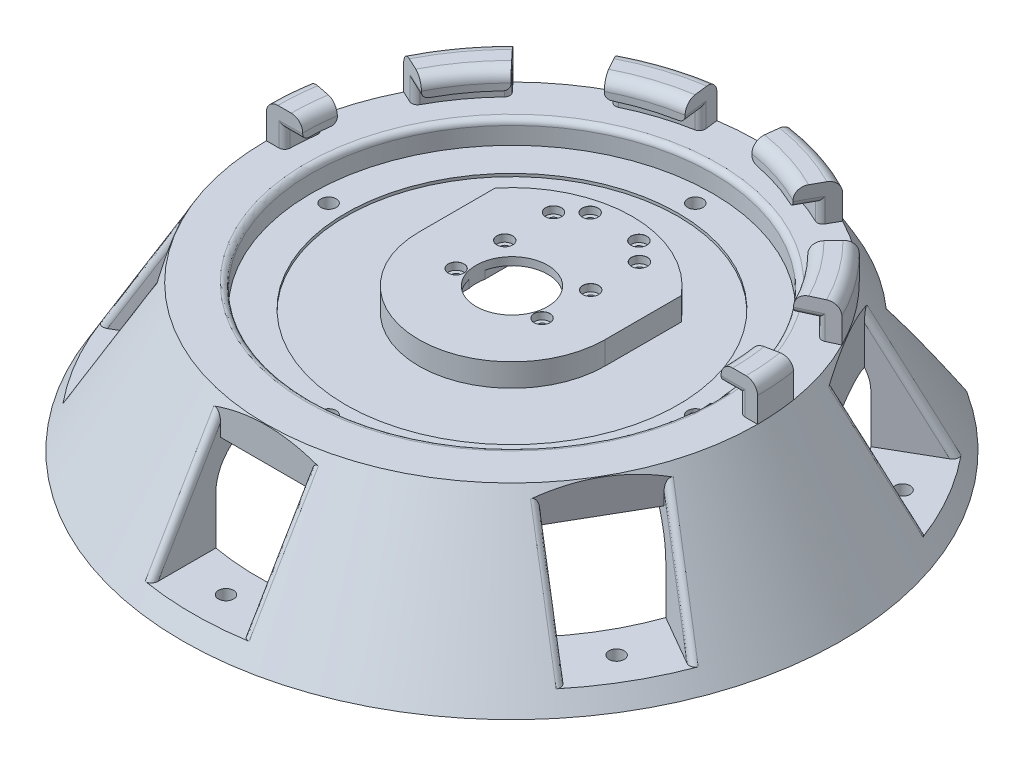
from build123d import *

# Parameters (mm, degrees)
SKETCH2_R                       = 12.5
CUT_EXTRUDE1_DEPTH              = 171.457229262
SKETCH3_R                       = 69.999999954
CUT_EXTRUDE2_DEPTH              = 8.000000002
CUT_EXTRUDE5_DEPTH              = 39
SKETCH8_W                       = 31.75
SKETCH8_H                       = 38.1
CUT_EXTRUDE6_DEPTH              = 44.45
CIRPATTERN2_COUNT               = 6
SKETCH9_R                       = 2.649982
CUT_EXTRUDE7_DEPTH              = 171.457229262
CIRPATTERN3_COUNT               = 6
REVOLVE2_ANGLE                  = 180
CUT_EXTRUDE9_DEPTH              = 12.7
SKETCH3_3_R                     = 12.5
CUT_EXTRUDE11_DEPTH             = 1
CBORE_FOR_M2_5_SHCS1_AT_2_COUNT = 2
CBORE_FOR_M2_5_SHCS1_AT_2_PITCH = 17
CBORE_FOR_M2_5_SHCS1_AT_3_COUNT = 2
CBORE_FOR_M2_5_SHCS1_AT_3_PITCH = 34
CBORE_FOR_M2_5_SHCS1_AT_4_COUNT = 2
CBORE_FOR_M2_5_SHCS1_AT_4_PITCH = 40.820828017
CBORE_FOR_M2_5_SHCS1_AT_5_COUNT = 2
CBORE_FOR_M2_5_SHCS1_AT_5_PITCH = 46.651259361
CBORE_FOR_M2_5_SHCS1_AT_6_COUNT = 2
CBORE_FOR_M2_5_SHCS1_AT_6_PITCH = 45.343136195
CBORE_FOR_M2_5_SHCS1_AT_7_COUNT = 2
CBORE_FOR_M2_5_SHCS1_AT_7_PITCH = 34.481879299
CBORE_FOR_M2_5_SHCS1_AT_8_COUNT = 2
CBORE_FOR_M2_5_SHCS1_AT_8_PITCH = 30
FILLET1_R                       = 4
FILLET2_R                       = 2
FILLET3_R                       = 2
FILLET4_R                       = 2
FILLET5_R                       = 2
FILLET6_R                       = 16
FILLET7_R                       = 16
FILLET8_R                       = 16
FILLET9_R                       = 1
CUT_EXTRUDE12_DEPTH             = 8.05
CUT_EXTRUDE15_START             = -5.3
SKETCH20_R                      = 1.45
CUT_EXTRUDE15_DEPTH             = 5.3
M5_CLEARANCE_HOLE1_D            = 5.3
SKETCH34_R                      = 58
CUT_EXTRUDE16_DEPTH             = 1


# Some blends are built 0.0001 mm under size
with BuildPart() as part:
    # Sketch1 → Revolve1 (revolve)
    with BuildSketch(Plane.XY, mode=Mode.PRIVATE) as revolve1_sk:
        Polygon((0, 0), (-85.725, 0), (-115.054393675, -50.8), (0, -50.8), align=None)
    revolve(revolve1_sk.sketch.rotate(Axis((0, 0, 0), (0, -1, 0)), 270), axis=Axis((0, 0, 0), (0, -1, 0)))

    # Sketch2 → Cut-Extrude1 (cut, through all)
    with BuildSketch(Plane(origin=(0, 0, 0), x_dir=(1, 0, 0), z_dir=(0, 1, 0))):
        with Locations(Location((0, 0, 0), (0, 0, 270))):
            Circle(SKETCH2_R)
    extrude(amount=-CUT_EXTRUDE1_DEPTH, mode=Mode.SUBTRACT)

    # Sketch3 → Cut-Extrude2 (cut)
    with BuildSketch(Plane(origin=(0, 0, 0), x_dir=(1, 0, 0), z_dir=(0, 1, 0))):
        with Locations(Location((0, 0, 0), (0, 0, 270))):
            Circle(SKETCH3_R)
        with BuildLine():
            ThreePointArc((32.5, 0), (0, -32.5), (-32.5, 0))
            Line((-32.5, 0), (-32.5, 26.603571189))
            ThreePointArc((-32.5, 26.603571189), (0, 42), (32.5, 26.603571189))
            Line((32.5, 26.603571189), (32.5, 0))
        make_face(mode=Mode.SUBTRACT)
    extrude(amount=-CUT_EXTRUDE2_DEPTH, mode=Mode.SUBTRACT)

    # Sketch7 → Cut-Extrude5 (cut)
    with BuildSketch(Plane.XZ.offset(50.8)):
        with BuildLine():
            Line((-60, -65.598856697), (-60, -161.1))
            Line((-60, -161.1), (60, -161.1))
            Line((60, -161.1), (60, -65.598856697))
            ThreePointArc((60, -65.598856697), (0, 88.9), (-60, -65.598856697))
        make_face()
    extrude(amount=-CUT_EXTRUDE5_DEPTH, mode=Mode.SUBTRACT)

    # Sketch8 → Cut-Extrude6 (cut)
    with BuildSketch(Plane(origin=(0, 0, 0), x_dir=(1, 0, 0), z_dir=(0, 1, 0))):
        with Locations((0, -104.875)):
            Rectangle(SKETCH8_W, SKETCH8_H)
    cut_extrude6 = extrude(amount=-CUT_EXTRUDE6_DEPTH, mode=Mode.SUBTRACT)

    # CirPattern2: Cut-Extrude6 ×6 about axis, 1 skipped
    cirpattern2_axis = Axis((0, 0, 0), (0, -1, 0))
    add([cut_extrude6.rotate(cirpattern2_axis, i * 360 / CIRPATTERN2_COUNT) for i in range(1, CIRPATTERN2_COUNT) if i not in (3,)], mode=Mode.SUBTRACT)

    # Sketch9 → Cut-Extrude7 (cut, through all)
    with BuildSketch(Plane(origin=(0, 0, 0), x_dir=(1, 0, 0), z_dir=(0, 1, 0))):
        with Locations(Location((0, -99.814393675, 0), (0, 0, 270))):
            Circle(SKETCH9_R)
    cut_extrude7 = extrude(amount=-CUT_EXTRUDE7_DEPTH, mode=Mode.SUBTRACT)

    # CirPattern3: Cut-Extrude7 ×6 about axis
    cirpattern3_axis = Axis((0, 0, 0), (0, 1, 0))
    for i in range(1, CIRPATTERN3_COUNT):
        add(cut_extrude7.rotate(cirpattern3_axis, i * 360 / CIRPATTERN3_COUNT), mode=Mode.SUBTRACT)

    # Sketch12 → Revolve2 (revolve)
    with BuildSketch(Plane.XY):
        Polygon((85.725, 0), (85.725, 12.7), (73.025, 12.7), (73.025, 6.35), (79.375, 6.35), (79.375, 0), align=None)
    revolve(axis=Axis((0, 0, 0), (0, 1, 0)), revolution_arc=REVOLVE2_ANGLE)

    # Sketch18 → Cut-Extrude9 (cut)
    with BuildSketch(Plane(origin=(0, 12.7, 0), x_dir=(1, 0, 0), z_dir=(0, 1, 0))):
        Polygon((46.643270314, 89.718478222), (70.913780145, 72.084920653), (36.670415564, 35.160782448), (22.108109665, 45.740916989), align=None)
        Polygon((-15, 100), (-9, 50), (9, 50), (15, 100), align=None)
        Polygon((90.470396714, 45.167547182), (99.740906545, 16.635851693), (50.333978764, 6.891341072), (44.771672865, 24.010358365), align=None)
        Polygon((99.740906545, -16.635851693), (90.470396714, -45.167547182), (44.771672865, -24.010358365), (50.333978764, -6.891341072), align=None)
        Polygon((70.913780145, -72.084920653), (46.643270314, -89.718478222), (22.108109665, -45.740916989), (36.670415564, -35.160782448), align=None)
        Polygon((15, -100), (-15, -100), (-9, -50), (9, -50), align=None)
        Polygon((-46.643270314, -89.718478222), (-70.913780145, -72.084920653), (-36.670415564, -35.160782448), (-22.108109665, -45.740916989), align=None)
        Polygon((-90.470396714, -45.167547182), (-99.740906545, -16.635851693), (-50.333978764, -6.891341072), (-44.771672865, -24.010358365), align=None)
        Polygon((-99.740906545, 16.635851693), (-90.470396714, 45.167547182), (-44.771672865, 24.010358365), (-50.333978764, 6.891341072), align=None)
        Polygon((-70.913780145, 72.084920653), (-46.643270314, 89.718478222), (-22.108109665, 45.740916989), (-36.670415564, 35.160782448), align=None)
    extrude(amount=-CUT_EXTRUDE9_DEPTH, mode=Mode.SUBTRACT)

    # Sketch3<3> → Cut-Extrude11 (cut)
    # profile 1 of 5: a face of its own
    with BuildSketch(Plane(origin=(0, 0, 0), x_dir=(1, 0, 0), z_dir=(0, 1, 0))):
        with BuildLine():
            ThreePointArc((-18.668154703, 26.603571189), (-28.835438507, 14.992247533), (-32.5, 0))
            ThreePointArc((-32.5, 0), (0, -32.5), (32.5, 0))
            ThreePointArc((32.5, 0), (28.835438507, 14.992247533), (18.668154703, 26.603571189))
            Line((18.668154703, 26.603571189), (-18.668154703, 26.603571189))
        make_face()
        with Locations(Location((0, 0, 0), (0, 0, 270))):
            Circle(SKETCH3_3_R, mode=Mode.SUBTRACT)
    # profile 2 of 5: a face of its own
    with BuildSketch(Plane(origin=(0, 0, 0), x_dir=(1, 0, 0), z_dir=(0, 1, 0))):
        with BuildLine():
            Line((-32.5, 26.603571189), (-32.5, 0))
            ThreePointArc((-32.5, 0), (-28.835438507, 14.992247533), (-18.668154703, 26.603571189))
            Line((-18.668154703, 26.603571189), (-32.5, 26.603571189))
        make_face()
    # profile 3 of 5: a face of its own
    with BuildSketch(Plane(origin=(0, 0, 0), x_dir=(1, 0, 0), z_dir=(0, 1, 0))):
        with BuildLine():
            ThreePointArc((18.668154703, 26.603571189), (0, 32.5), (-18.668154703, 26.603571189))
            Line((-18.668154703, 26.603571189), (18.668154703, 26.603571189))
        make_face()
    # profile 4 of 5: a face of its own
    with BuildSketch(Plane(origin=(0, 0, 0), x_dir=(1, 0, 0), z_dir=(0, 1, 0))):
        with BuildLine():
            ThreePointArc((32.5, 26.603571189), (0, 42), (-32.5, 26.603571189))
            Line((-32.5, 26.603571189), (-18.668154703, 26.603571189))
            ThreePointArc((-18.668154703, 26.603571189), (0, 32.5), (18.668154703, 26.603571189))
            Line((18.668154703, 26.603571189), (32.5, 26.603571189))
        make_face()
    # profile 5 of 5: a face of its own
    with BuildSketch(Plane(origin=(0, 0, 0), x_dir=(1, 0, 0), z_dir=(0, 1, 0))):
        with BuildLine():
            ThreePointArc((18.668154703, 26.603571189), (28.835438507, 14.992247533), (32.5, 0))
            Line((32.5, 0), (32.5, 26.603571189))
            Line((32.5, 26.603571189), (18.668154703, 26.603571189))
        make_face()
    extrude(amount=-CUT_EXTRUDE11_DEPTH, mode=Mode.SUBTRACT)

    # Sketch24 → CBORE for M2.5 SHCS1 (revolve, cut)
    with BuildSketch(Plane(origin=(-15, -1, 4.5), x_dir=(0, 0, 1), z_dir=(1, 0, 0))):
        Polygon((0, 0), (0, 49.8), (1.45, 49.8), (1.45, 2.5), (2.75, 2.5), (2.75, 0.025), (2.775, 0), align=None)
    cbore_for_m2_5_shcs1 = revolve(axis=Axis((-15, 5.35, 4.5), (0, -1, 0)), mode=Mode.SUBTRACT)

    # CBORE for M2.5 SHCS1 at 2: CBORE for M2.5 SHCS1 ×2
    with Locations(*[(0, 0, -i * CBORE_FOR_M2_5_SHCS1_AT_2_PITCH) for i in range(1, CBORE_FOR_M2_5_SHCS1_AT_2_COUNT)]):
        add(cbore_for_m2_5_shcs1, mode=Mode.SUBTRACT)

    # CBORE for M2.5 SHCS1 at 3: CBORE for M2.5 SHCS1 ×2
    with Locations(*[(0, 0, -i * CBORE_FOR_M2_5_SHCS1_AT_3_PITCH) for i in range(1, CBORE_FOR_M2_5_SHCS1_AT_3_COUNT)]):
        add(cbore_for_m2_5_shcs1, mode=Mode.SUBTRACT)

    # CBORE for M2.5 SHCS1 at 4: CBORE for M2.5 SHCS1 ×2
    with Locations(*[Vector(0.15923243882462063, 0, -0.9872411207126472) * (i * CBORE_FOR_M2_5_SHCS1_AT_4_PITCH) for i in range(1, CBORE_FOR_M2_5_SHCS1_AT_4_COUNT)]):
        add(cbore_for_m2_5_shcs1, mode=Mode.SUBTRACT)

    # CBORE for M2.5 SHCS1 at 5: CBORE for M2.5 SHCS1 ×2
    with Locations(*[Vector(0.5037377408822789, 0, -0.8638566364917376) * (i * CBORE_FOR_M2_5_SHCS1_AT_5_PITCH) for i in range(1, CBORE_FOR_M2_5_SHCS1_AT_5_COUNT)]):
        add(cbore_for_m2_5_shcs1, mode=Mode.SUBTRACT)

    # CBORE for M2.5 SHCS1 at 6: CBORE for M2.5 SHCS1 ×2
    with Locations(*[Vector(0.6616216370868465, 0, -0.7498378553650925) * (i * CBORE_FOR_M2_5_SHCS1_AT_6_PITCH) for i in range(1, CBORE_FOR_M2_5_SHCS1_AT_6_COUNT)]):
        add(cbore_for_m2_5_shcs1, mode=Mode.SUBTRACT)

    # CBORE for M2.5 SHCS1 at 7: CBORE for M2.5 SHCS1 ×2
    with Locations(*[Vector(0.8700221858486125, 0, -0.4930125719808802) * (i * CBORE_FOR_M2_5_SHCS1_AT_7_PITCH) for i in range(1, CBORE_FOR_M2_5_SHCS1_AT_7_COUNT)]):
        add(cbore_for_m2_5_shcs1, mode=Mode.SUBTRACT)

    # CBORE for M2.5 SHCS1 at 8: CBORE for M2.5 SHCS1 ×2
    with Locations(*[(i * CBORE_FOR_M2_5_SHCS1_AT_8_PITCH, 0, 0) for i in range(1, CBORE_FOR_M2_5_SHCS1_AT_8_COUNT)]):
        add(cbore_for_m2_5_shcs1, mode=Mode.SUBTRACT)

    # Fillet1
    fillet1_edges = [part.edges().sort_by_distance(p)[0] for p in [
        (-85.450905057, 12.7, -6.849704366),
        (-72.808821363, 12.7, -5.614815819),
        (-59.078466014, 12.7, -42.923018049),
        (-22.565966014, 12.7, -69.450902102),
        (22.565966014, 12.7, -69.450902102),
        (59.078466014, 12.7, -42.923018049),
        (72.808821363, 12.7, -5.614815819),
        (-69.352981843, 12.7, -50.387890753),
        (-26.490481843, 12.7, -81.529319859),
        (26.490481843, 12.7, -81.529319859),
        (69.352981843, 12.7, -50.387890753),
        (85.450905057, 12.7, -6.849704365),
    ]]
    fillet(fillet1_edges, radius=FILLET1_R)

    # Fillet2
    fillet2_edges = [part.edges().sort_by_distance(p)[0] for p in [
        (-76.2, 6.35, 0),
        (76.2, 6.35, 0),
        (67.844410645, 6.35, -34.692369341),
        (75.278944251, 6.35, -11.811227656),
        (34.49561812, 6.35, -67.9446604),
        (53.95947979, 6.35, -53.803337137),
        (-75.278944251, 6.35, -11.811227656),
        (-67.844410645, 6.35, -34.692369341),
        (-53.95947979, 6.35, -53.803337137),
        (-34.49561812, 6.35, -67.9446604),
        (12.029328065, 6.35, -75.24440054),
        (-12.029328065, 6.35, -75.24440054),
    ]]
    fillet(fillet2_edges, radius=FILLET2_R)

    # Fillet3
    fillet3_edges = [part.edges().sort_by_distance(p)[0] for p in [
        (-78.396323126, 4.175, -12.426067172),
        (-56.120098678, 4.175, -56.133102082),
        (-70.727816733, 4.175, -36.027303052),
        (-12.407903987, 4.175, -78.399199892),
        (56.120098678, 4.175, -56.133102082),
        (78.396323126, 4.175, -12.426067171),
        (-79.375, 4.175, 0),
        (-36.043688298, 4.175, -70.719468033),
        (12.407903987, 4.175, -78.399199892),
        (36.043688298, 4.175, -70.719468033),
        (70.727816733, 4.175, -36.027303052),
        (79.375, 4.175, 0),
    ]]
    fillet(fillet3_edges, radius=FILLET3_R)

    # Fillet4
    fillet4_edges = [part.edges().sort_by_distance(p)[0] for p in [
        (92.853698409, -23.56380487, 35.278236725),
        (76.978698409, -23.56380487, 62.774543295),
        (76.978698409, -23.56380487, -62.774543295),
        (92.853698409, -23.56380487, -35.278236725),
        (-92.853698409, -23.56380487, -35.278236725),
        (-76.978698409, -23.56380487, -62.774543295),
        (-76.978698409, -23.56380487, 62.774543295),
        (-92.853698409, -23.56380487, 35.278236725),
        (15.875, -23.56380487, 98.05278002),
        (-15.875, -23.56380487, 98.05278002),
    ]]
    fillet(fillet4_edges, radius=FILLET4_R)

    # Fillet5
    fillet5_edges = [part.edges().sort_by_distance(p)[0] for p in [
        (0, 0, -69.999999954),
    ]]
    fillet(fillet5_edges, radius=FILLET5_R)

    # Fillet6
    # the kernel refuses this fillet: 16 mm, written as the material it adds along each edge
    with BuildSketch(Plane(origin=(0, -11.8, 0), x_dir=(0.26715940650180947, 0, 0.9636523499258438), z_dir=(0.9636523499258438, 0, -0.26715940650180947))) as fillet6_piece_1_section:
        with BuildLine():
            CenterArc((88.9 - FILLET6_R, FILLET6_R), FILLET6_R, 270, 90)
            Line((88.9, FILLET6_R), (88.9, 0))
            Line((88.9, 0), (88.9 - FILLET6_R, 0))
        make_face()
    fillet6_piece_1 = revolve(axis=Axis((0, -11.8, 0), (0, -1, 0)), revolution_arc=90.990609321, mode=Mode.PRIVATE)
    fillet6_piece_1 = split(fillet6_piece_1, bisect_by=Plane(origin=(15.875, -14.981885519, 82.675852162), z_dir=(1, 0, 0)), keep=Keep.TOP, mode=Mode.PRIVATE)
    add(fillet6_piece_1)
    with BuildSketch(Plane(origin=(0, -11.8, 0), x_dir=(0.26715940650180947, 0, 0.9636523499258438), z_dir=(0.9636523499258438, 0, -0.26715940650180947))) as fillet6_piece_2_section:
        with BuildLine():
            CenterArc((88.9 - FILLET6_R, FILLET6_R), FILLET6_R, 270, 90)
            Line((88.9, FILLET6_R), (88.9, 0))
            Line((88.9, 0), (88.9 - FILLET6_R, 0))
        make_face()
    fillet6_piece_2 = revolve(axis=Axis((0, -11.8, 0), (0, -1, 0)), revolution_arc=90.990609321, mode=Mode.PRIVATE)
    fillet6_piece_2 = split(fillet6_piece_2, bisect_by=Plane(origin=(-54.96696383, -15.341247378, 50.066062411), z_dir=(0.5000000000000001, 0, 0.8660254037844386)), keep=Keep.TOP, mode=Mode.PRIVATE)
    fillet6_piece_2 = split(fillet6_piece_2, bisect_by=Plane(origin=(-15.875, -15.341247378, 72.635817925), z_dir=(-1, 0, 0)), keep=Keep.TOP, mode=Mode.PRIVATE)
    add(fillet6_piece_2)
    with BuildSketch(Plane(origin=(0, -11.8, 0), x_dir=(0.26715940650180947, 0, 0.9636523499258438), z_dir=(0.9636523499258438, 0, -0.26715940650180947))) as fillet6_piece_3_section:
        with BuildLine():
            CenterArc((88.9 - FILLET6_R, FILLET6_R), FILLET6_R, 270, 90)
            Line((88.9, FILLET6_R), (88.9, 0))
            Line((88.9, 0), (88.9 - FILLET6_R, 0))
        make_face()
    fillet6_piece_3 = revolve(axis=Axis((0, -11.8, 0), (0, -1, 0)), revolution_arc=90.990609321, mode=Mode.PRIVATE)
    fillet6_piece_3 = split(fillet6_piece_3, bisect_by=Plane(origin=(-79.536888464, -14.981885707, 27.589772918), z_dir=(-0.5000000000000001, 0, -0.8660254037844386)), keep=Keep.TOP, mode=Mode.PRIVATE)
    add(fillet6_piece_3)
    with BuildSketch(Plane(origin=(0, -11.8, 0), x_dir=(0.7009677122014474, 0, -0.7131930078534623), z_dir=(-0.7131930078534623, 0, -0.7009677122014474))) as fillet6_piece_4_section:
        with BuildLine():
            CenterArc((88.9 - FILLET6_R, FILLET6_R), FILLET6_R, 270, 90)
            Line((88.9, FILLET6_R), (88.9, 0))
            Line((88.9, 0), (88.9 - FILLET6_R, 0))
        make_face()
    fillet6_piece_4 = revolve(axis=Axis((0, -11.8, 0), (0, -1, 0)), revolution_arc=90.990609321, mode=Mode.PRIVATE)
    fillet6_piece_4 = split(fillet6_piece_4, bisect_by=Plane(origin=(70.84196383, -15.341247378, 22.56975584), z_dir=(0.5000000000000001, 0, -0.8660254037844386)), keep=Keep.TOP, mode=Mode.PRIVATE)
    fillet6_piece_4 = split(fillet6_piece_4, bisect_by=Plane(origin=(70.841963547, -15.341247378, -22.569755677), z_dir=(0.5000000000000004, 0, 0.8660254037844384)), keep=Keep.TOP, mode=Mode.PRIVATE)
    add(fillet6_piece_4)
    with BuildSketch(Plane(origin=(0, -11.8, 0), x_dir=(0.7009677122014474, 0, -0.7131930078534623), z_dir=(-0.7131930078534623, 0, -0.7009677122014474))) as fillet6_piece_5_section:
        with BuildLine():
            CenterArc((88.9 - FILLET6_R, FILLET6_R), FILLET6_R, 270, 90)
            Line((88.9, FILLET6_R), (88.9, 0))
            Line((88.9, 0), (88.9 - FILLET6_R, 0))
        make_face()
    fillet6_piece_5 = revolve(axis=Axis((0, -11.8, 0), (0, -1, 0)), revolution_arc=90.990609321, mode=Mode.PRIVATE)
    fillet6_piece_5 = split(fillet6_piece_5, bisect_by=Plane(origin=(63.661888464, -14.981885707, 55.086079488), z_dir=(-0.5000000000000001, 0, 0.8660254037844386)), keep=Keep.TOP, mode=Mode.PRIVATE)
    add(fillet6_piece_5)
    with BuildSketch(Plane(origin=(0, -11.8, 0), x_dir=(0.9681271187032567, 0, 0.2504593420723819), z_dir=(0.2504593420723819, 0, -0.9681271187032567))) as fillet6_piece_6_section:
        with BuildLine():
            CenterArc((88.9 - FILLET6_R, FILLET6_R), FILLET6_R, 270, 90)
            Line((88.9, FILLET6_R), (88.9, 0))
            Line((88.9, 0), (88.9 - FILLET6_R, 0))
        make_face()
    fillet6_piece_6 = revolve(axis=Axis((0, -11.8, 0), (0, -1, 0)), revolution_arc=90.990609321, mode=Mode.PRIVATE)
    fillet6_piece_6 = split(fillet6_piece_6, bisect_by=Plane(origin=(79.536888252, -14.981885519, 27.589772796), z_dir=(0.5000000000000001, 0, -0.8660254037844386)), keep=Keep.TOP, mode=Mode.PRIVATE)
    add(fillet6_piece_6)
    with BuildSketch(Plane(origin=(0, -11.8, 0), x_dir=(0.9681271187032567, 0, 0.2504593420723819), z_dir=(0.2504593420723819, 0, -0.9681271187032567))) as fillet6_piece_7_section:
        with BuildLine():
            CenterArc((88.9 - FILLET6_R, FILLET6_R), FILLET6_R, 270, 90)
            Line((88.9, FILLET6_R), (88.9, 0))
            Line((88.9, 0), (88.9 - FILLET6_R, 0))
        make_face()
    fillet6_piece_7 = revolve(axis=Axis((0, -11.8, 0), (0, -1, 0)), revolution_arc=90.990609321, mode=Mode.PRIVATE)
    fillet6_piece_7 = split(fillet6_piece_7, bisect_by=Plane(origin=(54.966963547, -15.341247378, 50.066062247), z_dir=(-0.5000000000000001, 0, 0.8660254037844386)), keep=Keep.TOP, mode=Mode.PRIVATE)
    fillet6_piece_7 = split(fillet6_piece_7, bisect_by=Plane(origin=(15.875, -15.341247378, 72.635818251), z_dir=(1, 0, 0)), keep=Keep.TOP, mode=Mode.PRIVATE)
    add(fillet6_piece_7)
    with BuildSketch(Plane(origin=(0, -11.8, 0), x_dir=(0.9681271187032567, 0, 0.2504593420723819), z_dir=(0.2504593420723819, 0, -0.9681271187032567))) as fillet6_piece_8_section:
        with BuildLine():
            CenterArc((88.9 - FILLET6_R, FILLET6_R), FILLET6_R, 270, 90)
            Line((88.9, FILLET6_R), (88.9, 0))
            Line((88.9, 0), (88.9 - FILLET6_R, 0))
        make_face()
    fillet6_piece_8 = revolve(axis=Axis((0, -11.8, 0), (0, -1, 0)), revolution_arc=90.990609321, mode=Mode.PRIVATE)
    fillet6_piece_8 = split(fillet6_piece_8, bisect_by=Plane(origin=(-15.875, -14.981885707, 82.675852407), z_dir=(-1, 0, 0)), keep=Keep.TOP, mode=Mode.PRIVATE)
    add(fillet6_piece_8)
    with BuildSketch(Plane(origin=(0, -11.8, 0), x_dir=(-0.7009677122014484, 0, 0.7131930078534614), z_dir=(0.7131930078534614, 0, 0.7009677122014484))) as fillet6_piece_9_section:
        with BuildLine():
            CenterArc((88.9 - FILLET6_R, FILLET6_R), FILLET6_R, 270, 90)
            Line((88.9, FILLET6_R), (88.9, 0))
            Line((88.9, 0), (88.9 - FILLET6_R, 0))
        make_face()
    fillet6_piece_9 = revolve(axis=Axis((0, -11.8, 0), (0, -1, 0)), revolution_arc=90.990609321, mode=Mode.PRIVATE)
    fillet6_piece_9 = split(fillet6_piece_9, bisect_by=Plane(origin=(-63.661888252, -14.981885519, 55.086079366), z_dir=(0.5000000000000001, 0, 0.8660254037844386)), keep=Keep.TOP, mode=Mode.PRIVATE)
    add(fillet6_piece_9)
    with BuildSketch(Plane(origin=(0, -11.8, 0), x_dir=(-0.7009677122014484, 0, 0.7131930078534614), z_dir=(0.7131930078534614, 0, 0.7009677122014484))) as fillet6_piece_10_section:
        with BuildLine():
            CenterArc((88.9 - FILLET6_R, FILLET6_R), FILLET6_R, 270, 90)
            Line((88.9, FILLET6_R), (88.9, 0))
            Line((88.9, 0), (88.9 - FILLET6_R, 0))
        make_face()
    fillet6_piece_10 = revolve(axis=Axis((0, -11.8, 0), (0, -1, 0)), revolution_arc=90.990609321, mode=Mode.PRIVATE)
    fillet6_piece_10 = split(fillet6_piece_10, bisect_by=Plane(origin=(-70.84196383, -15.341247378, -22.56975584), z_dir=(-0.49999999999999983, 0, 0.8660254037844388)), keep=Keep.TOP, mode=Mode.PRIVATE)
    fillet6_piece_10 = split(fillet6_piece_10, bisect_by=Plane(origin=(-70.841963547, -15.341247378, 22.569755677), z_dir=(-0.5000000000000001, 0, -0.8660254037844386)), keep=Keep.TOP, mode=Mode.PRIVATE)
    add(fillet6_piece_10)

    # Fillet7
    fillet7_edges = [part.edges().sort_by_distance(p)[0] for p in [
        (64.036031191, -11.8, -61.665198526),
    ]]
    fillet(fillet7_edges, radius=FILLET7_R - 0.0001)  # a hair under: the kernel refuses the full size

    # Fillet8
    # the kernel refuses this fillet: 16 mm, written as the material it adds along each edge
    with BuildSketch(Plane(origin=(0, -11.8, 0), x_dir=(-0.9681187273777495, 0, -0.25049177571426695), z_dir=(-0.25049177571426695, 0, 0.9681187273777495))) as fillet8_piece_1_section:
        with BuildLine():
            CenterArc((88.9 - FILLET8_R, FILLET8_R), FILLET8_R, 270, 90)
            Line((88.9 - FILLET8_R, 0), (88.9, 0))
            Line((88.9, 0), (88.9, FILLET8_R))
        make_face()
    fillet8_piece_1 = revolve(axis=Axis((0, -11.8, 0), (0, -1, 0)), revolution_arc=58.825731772, mode=Mode.PRIVATE)
    fillet8_piece_1 = split(fillet8_piece_1, bisect_by=Plane(origin=(-74.398229209, -13.906298809, -42.788487017), z_dir=(0.8660254037844388, 0, 0.49999999999999983)), keep=Keep.TOP, mode=Mode.PRIVATE)
    fillet8_piece_1 = split(fillet8_piece_1, bisect_by=Plane(origin=(-60, -13.906298809, -41.216396761), z_dir=(-1, 0, 0)), keep=Keep.TOP, mode=Mode.PRIVATE)
    add(fillet8_piece_1)
    with BuildSketch(Plane(origin=(0, -11.8, 0), x_dir=(-0.9681187273777495, 0, -0.25049177571426695), z_dir=(-0.25049177571426695, 0, 0.9681187273777495))) as fillet8_piece_2_section:
        with BuildLine():
            CenterArc((88.9 - FILLET8_R, FILLET8_R), FILLET8_R, 270, 90)
            Line((88.9 - FILLET8_R, 0), (88.9, 0))
            Line((88.9, 0), (88.9, FILLET8_R))
        make_face()
    fillet8_piece_2 = revolve(axis=Axis((0, -11.8, 0), (0, -1, 0)), revolution_arc=58.825731772, mode=Mode.PRIVATE)
    fillet8_piece_2 = split(fillet8_piece_2, bisect_by=Plane(origin=(-66.903440173, -17.970411927, -56.957590241), z_dir=(0.4999999999999998, 0, -0.8660254037844388)), keep=Keep.TOP, mode=Mode.PRIVATE)
    fillet8_piece_2 = split(fillet8_piece_2, bisect_by=Plane(origin=(-60, -17.970411927, -59.221513101), z_dir=(-1, 0, 0)), keep=Keep.TOP, mode=Mode.PRIVATE)
    add(fillet8_piece_2)

    # Fillet9
    fillet9_edges = [part.edges().sort_by_distance(p)[0] for p in [
        (-60, -31.116866881, -84.56763471),
        (60, -31.116866881, -84.56763471),
    ]]
    fillet(fillet9_edges, radius=FILLET9_R)

    # Sketch28 → Cut-Extrude12 (cut)
    with BuildSketch(Plane.XZ.offset(11.8)):
        with BuildLine():
            Line((9.2, 12), (-9.2, 12))
            ThreePointArc((-9.2, 12), (-11.321320344, 11.121320344), (-12.2, 9))
            Line((-12.2, 9), (-12.2, -30))
            ThreePointArc((-12.2, -30), (-11.321320344, -32.121320344), (-9.2, -33))
            Line((-9.2, -33), (9.2, -33))
            ThreePointArc((9.2, -33), (11.321320344, -32.121320344), (12.2, -30))
            Line((12.2, -30), (12.2, 9))
            ThreePointArc((12.2, 9), (11.321320344, 11.121320344), (9.2, 12))
        make_face()
    extrude(amount=-CUT_EXTRUDE12_DEPTH, mode=Mode.SUBTRACT)

    # Sketch20 → Cut-Extrude15 (cut)
    with BuildSketch(Plane.XZ.offset(11.8).offset(CUT_EXTRUDE15_START)):
        Polygon((-22.5, 23), (-22.5, -33), (-12.5, -40), (12.5, -40), (22.5, -33), (22.5, 23), align=None)
        with Locations(Location((-15, -29.5, 0), (0, 0, 90))):
            Circle(SKETCH20_R, mode=Mode.SUBTRACT)
        with Locations(Location((-8.5, -35.8, 0), (0, 0, 90))):
            Circle(SKETCH20_R, mode=Mode.SUBTRACT)
        with Locations(Location((-15, -12.5, 0), (0, 0, 90))):
            Circle(SKETCH20_R, mode=Mode.SUBTRACT)
        with BuildLine():
            Line((-9.2, 12), (-3.5, 12))
            ThreePointArc((-3.5, 12), (-1.767766953, 12.374368671), (0, 12.5))
            ThreePointArc((0, 12.5), (1.767766953, 12.374368671), (3.5, 12))
            Line((3.5, 12), (9.2, 12))
            ThreePointArc((9.2, 12), (11.321320344, 11.121320344), (12.2, 9))
            Line((12.2, 9), (12.2, 2.722131518))
            ThreePointArc((12.2, 2.722131518), (12.5, 0), (12.2, -2.722131518))
            Line((12.2, -2.722131518), (12.2, -30))
            ThreePointArc((12.2, -30), (11.321320344, -32.121320344), (9.2, -33))
            Line((9.2, -33), (-9.2, -33))
            ThreePointArc((-9.2, -33), (-11.321320344, -32.121320344), (-12.2, -30))
            Line((-12.2, -30), (-12.2, -2.722131518))
            ThreePointArc((-12.2, -2.722131518), (-12.5, 0), (-12.2, 2.722131518))
            Line((-12.2, 2.722131518), (-12.2, 9))
            ThreePointArc((-12.2, 9), (-11.321320344, 11.121320344), (-9.2, 12))
        make_face(mode=Mode.SUBTRACT)
        with Locations(Location((8.5, -35.8, 0), (0, 0, 90))):
            Circle(SKETCH20_R, mode=Mode.SUBTRACT)
        with Locations(Location((15, -29.5, 0), (0, 0, 90))):
            Circle(SKETCH20_R, mode=Mode.SUBTRACT)
        with Locations(Location((15, -12.5, 0), (0, 0, 90))):
            Circle(SKETCH20_R, mode=Mode.SUBTRACT)
        with Locations(Location((-15, 4.5, 0), (0, 0, 90))):
            Circle(SKETCH20_R, mode=Mode.SUBTRACT)
        with Locations(Location((15, 4.5, 0), (0, 0, 90))):
            Circle(SKETCH20_R, mode=Mode.SUBTRACT)
    extrude(amount=CUT_EXTRUDE15_DEPTH, mode=Mode.SUBTRACT)

    # M5 Clearance Hole1 (through all)
    with Locations(Plane(origin=(0, -8.000000002, 0), x_dir=(1, 0, 0), z_dir=(0, 1, 0))):
        with Locations((0, 64), (64, 0), (0, -64), (-64, 0)):
            Hole(M5_CLEARANCE_HOLE1_D / 2)

    # Sketch34 → Cut-Extrude16 (cut)
    with BuildSketch(Plane(origin=(0, -8.000000002, 0), x_dir=(1, 0, 0), z_dir=(0, 1, 0))):
        with Locations(Location((0, 0, 0), (0, 0, 270))):
            Circle(SKETCH34_R)
        with BuildLine():
            ThreePointArc((32.5, 0), (0, -32.5), (-32.5, 0))
            Line((-32.5, 0), (-32.5, 26.603571189))
            ThreePointArc((-32.5, 26.603571189), (0, 42), (32.5, 26.603571189))
            Line((32.5, 26.603571189), (32.5, 0))
        make_face(mode=Mode.SUBTRACT)
    extrude(amount=-CUT_EXTRUDE16_DEPTH, mode=Mode.SUBTRACT)


solid = part.part
